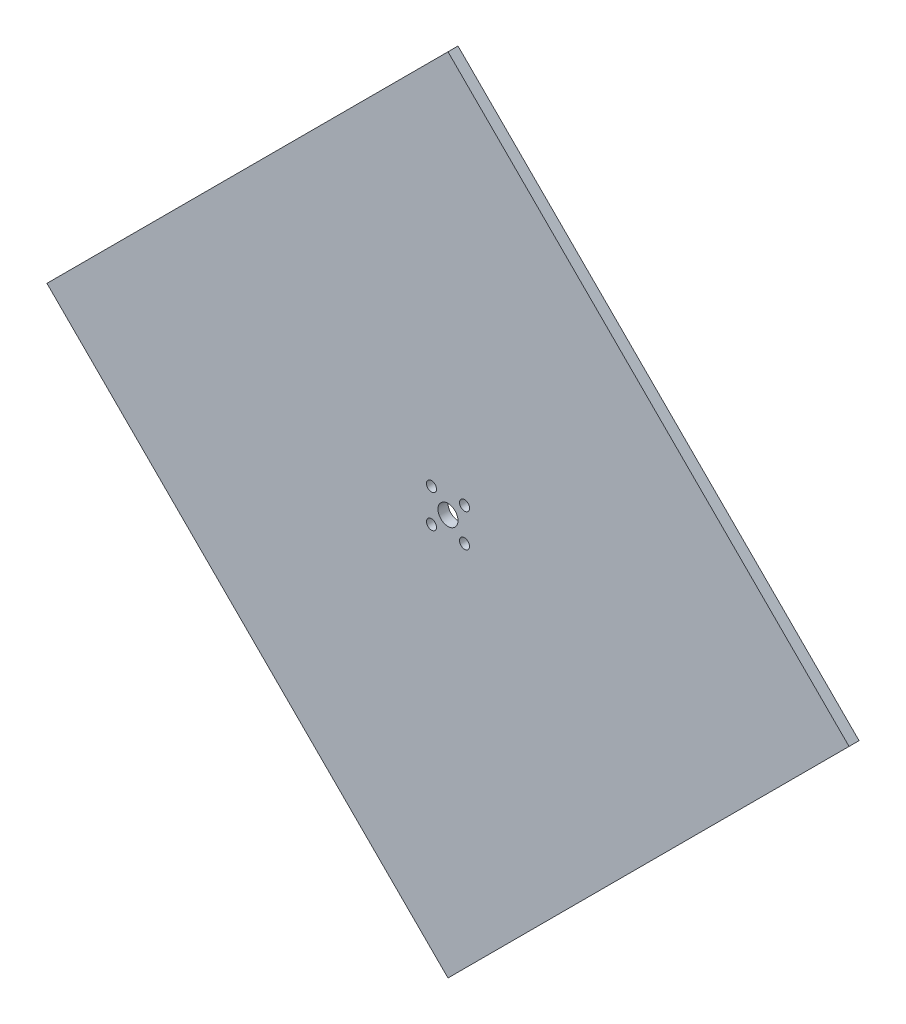
from build123d import *

# Parameters (mm, degrees)
SKETCH_1_W          = 170
SKETCH_1_H          = 170
EXTRUDE_1_DEPTH     = 3
SKETCH_3_R          = 3
SKETCH_3_R_2        = 1.5
CUT_EXTRUDE_1_DEPTH = 121.245582039
FILLET_1_R          = 2
CUT_EXTRUDE_START   = -10
CUT_EXTRUDE_2_DEPTH = 10
CUT_EXTRUDE_START_2 = -3
CUT_EXTRUDE_3_DEPTH = 3
EXTRUDE_4_DEPTH     = 3


with BuildPart() as part:
    # 草图1 → 凸台-拉伸1 (new body)
    with BuildSketch(Plane.XY):
        Rectangle(SKETCH_1_W, SKETCH_1_H)
    extrude(amount=EXTRUDE_1_DEPTH)

    # 草图3 → 切除-拉伸1 (cut, through all)
    with BuildSketch(Plane(origin=(0, 0, 0), x_dir=(-1, 0, 0), z_dir=(0, 0, -1))):
        Circle(SKETCH_3_R)
        with Locations((4.95, 4.95)):
            Circle(SKETCH_3_R_2)
        with Locations((-4.95, 4.95)):
            Circle(SKETCH_3_R_2)
        with Locations((-4.95, -4.95)):
            Circle(SKETCH_3_R_2)
        with Locations((4.95, -4.95)):
            Circle(SKETCH_3_R_2)
    extrude(amount=-CUT_EXTRUDE_1_DEPTH, mode=Mode.SUBTRACT)

    # 圆角1
    fillet_1_edges = [part.edges().sort_by_distance(p)[0] for p in [
        (85, -85, 1.5),
        (85, 85, 1.5),
        (-85, -85, 1.5),
        (-85, 85, 1.5),
    ]]
    fillet(fillet_1_edges, radius=FILLET_1_R)

    # 草图4 → 切除-拉伸2 (cut)
    with BuildSketch(Plane(origin=(0, 0, 0), x_dir=(-1, 0, 0), z_dir=(0, 0, -1)).offset(CUT_EXTRUDE_START)):
        with BuildLine():
            Line((85, -35.208152802), (35.208152802, -85))
            Line((35.208152802, -85), (83, -85))
            ThreePointArc((83, -85), (84.414213562, -84.414213562), (85, -83))
            Line((85, -83), (85, -35.208152802))
        make_face()
        with BuildLine():
            Line((-85, 35.208152802), (-35.208152802, 85))
            Line((-35.208152802, 85), (-83, 85))
            ThreePointArc((-83, 85), (-84.414213562, 84.414213562), (-85, 83))
            Line((-85, 83), (-85, 35.208152802))
        make_face()
    extrude(amount=CUT_EXTRUDE_2_DEPTH, mode=Mode.SUBTRACT)

    # 草图6 → 切除-拉伸3 (cut)
    with BuildSketch(Plane(origin=(0, 0, 0), x_dir=(-1, 0, 0), z_dir=(0, 0, -1)).offset(CUT_EXTRUDE_START_2)):
        with BuildLine():
            Line((-35.208152802, -85), (-85, -35.208152802))
            Line((-85, -35.208152802), (-85, -83))
            ThreePointArc((-85, -83), (-84.414213562, -84.414213562), (-83, -85))
            Line((-83, -85), (-35.208152802, -85))
        make_face()
        with BuildLine():
            Line((35.208152802, 85), (85, 35.208152802))
            Line((85, 35.208152802), (85, 83))
            ThreePointArc((85, 83), (84.414213562, 84.414213562), (83, 85))
            Line((83, 85), (35.208152802, 85))
        make_face()
    extrude(amount=CUT_EXTRUDE_3_DEPTH, mode=Mode.SUBTRACT)

    # 草图7 → 凸台-拉伸4 (add)
    with BuildSketch(Plane(origin=(0, 0, 0), x_dir=(-1, 0, 0), z_dir=(0, 0, -1))):
        Polygon((-85, 35.208152802), (-120.208152802, 0), (-85, -35.208152802), align=None)
        Polygon((0, 120.208152802), (-35.208152802, 85), (35.208152802, 85), align=None)
        Polygon((35.208152802, -85), (-35.208152802, -85), (0, -120.208152802), align=None)
        Polygon((120.208152802, 0), (85, 35.208152802), (85, -35.208152802), align=None)
    extrude(amount=-EXTRUDE_4_DEPTH)


solid = part.part
